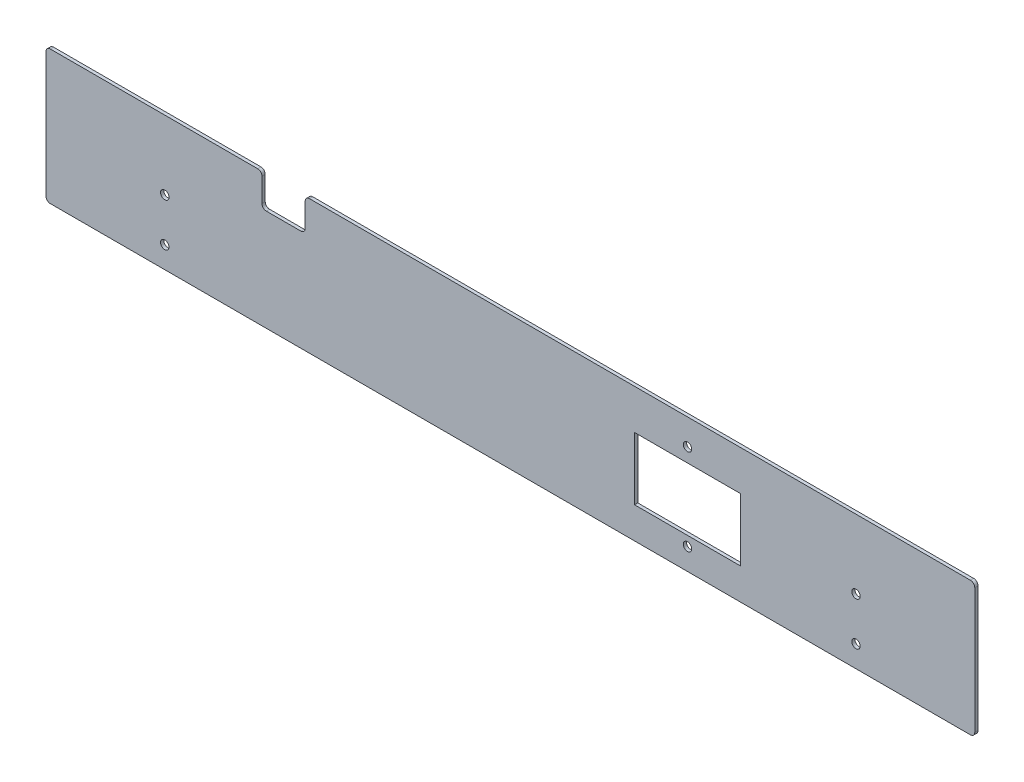
from build123d import *

# Parameters (mm, degrees)
SKETCH1_R           = 1.95
SKETCH1_W           = 49
SKETCH1_H           = 29
BOSS_EXTRUDE1_DEPTH = 1.5
FILLET1_R           = 2
SKETCH3_R           = 1.95
CUT_EXTRUDE1_DEPTH  = 10


with BuildPart() as part:
    # Sketch1 → Boss-Extrude1 (new body)
    with BuildSketch(Plane.XY):
        Polygon((-231.924811832, 29.703517588), (78.075188168, 29.703517588), (78.075188168, -32.296482412), (-351.924811832, -32.296482412), (-351.924811832, 29.703517588), (-251.924811832, 29.703517588), (-251.924811832, 14.703517588), (-231.924811832, 14.703517588), align=None)
        with Locations((-54.924811832, 17.703517588)):
            Circle(SKETCH1_R, mode=Mode.SUBTRACT)
        with Locations((-54.924811832, -22.296482412)):
            Circle(SKETCH1_R, mode=Mode.SUBTRACT)
        with Locations((-54.924811832, -3.296482412)):
            Rectangle(SKETCH1_W, SKETCH1_H, mode=Mode.SUBTRACT)
    extrude(amount=BOSS_EXTRUDE1_DEPTH)

    # Fillet1
    fillet1_edges = [part.edges().sort_by_distance(p)[0] for p in [
        (78.075188168, -32.296482412, 0.75),
        (-351.924811832, -32.296482412, 0.75),
        (-351.924811832, 29.703517588, 0.75),
        (-231.924811832, 14.703517588, 0.75),
        (-251.924811832, 14.703517588, 0.75),
        (-251.924811832, 29.703517588, 0.75),
        (-231.924811832, 29.703517588, 0.75),
        (78.075188168, 29.703517588, 0.75),
    ]]
    fillet(fillet1_edges, radius=FILLET1_R)

    # Sketch3 → Cut-Extrude1 (cut)
    with BuildSketch(Plane(origin=(0, 0, 0), x_dir=(-1, 0, 0), z_dir=(0, 0, -1))):
        with Locations((-23.075188168, -22.296482412)):
            Circle(SKETCH3_R)
        with Locations((-23.075188168, -2.296482412)):
            Circle(SKETCH3_R)
        with Locations((296.924811832, -22.296482412)):
            Circle(SKETCH3_R)
        with Locations((296.924811832, -2.296482412)):
            Circle(SKETCH3_R)
    extrude(amount=-CUT_EXTRUDE1_DEPTH, mode=Mode.SUBTRACT)


solid = part.part
